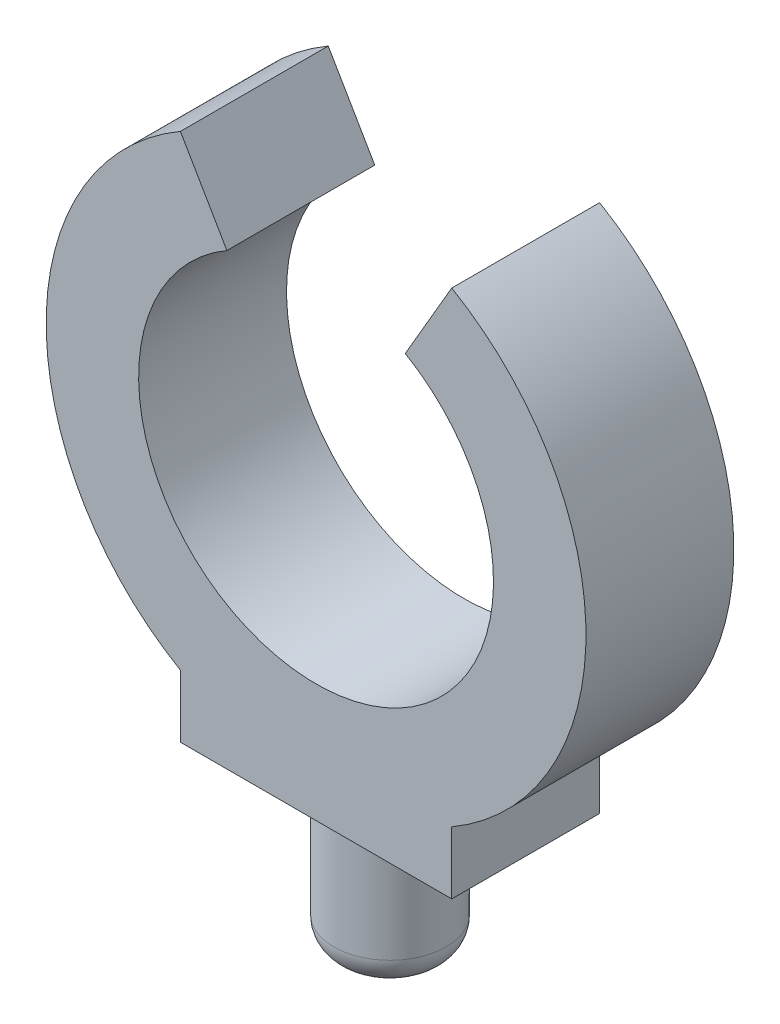
from build123d import *

# Parameters (mm, degrees)
RESSALTO_EXTRUS_O1_DEPTH     = 5
RESSALTO_EXTRUS_O2_START     = -15
RESSALTO_EXTRUS_O2_OUTLINE_R = 1.9
RESSALTO_EXTRUS_O2_DEPTH     = 5
FILETE5_R                    = 1


# Read off the part's stored shape, not the designer's step: Ressalto-extrusão2
with BuildPart() as part:
    # Esboço1 → Ressalto-extrusão1 (new body)
    with BuildSketch(Plane.XY):
        with BuildLine():
            Line((4.587776734, -7.88962854), (4.587776734, -10))
            Line((4.587776734, -10), (-4.587776734, -10))
            Line((-4.587776734, -10), (-4.587776734, -7.88962854))
            ThreePointArc((-4.587776734, -7.88962854), (-9.126551039, 0), (-4.587776734, 7.88962854))
            Line((-4.587776734, 7.88962854), (-3.01610765, 5.186819319))
            ThreePointArc((-3.01610765, 5.186819319), (0, -6), (3.01610765, 5.186819319))
            Line((3.01610765, 5.186819319), (4.587776734, 7.88962854))
            ThreePointArc((4.587776734, 7.88962854), (9.126551039, 0), (4.587776734, -7.88962854))
        make_face()
    extrude(amount=RESSALTO_EXTRUS_O1_DEPTH)

    # Ressalto-extrusão2 outline → Ressalto-extrusão2 (add)
    with BuildSketch(Plane(origin=(0, 0, 0), x_dir=(1, 0, 0), z_dir=(0, 1, 0)).offset(RESSALTO_EXTRUS_O2_START)):
        with Locations((0, -2.5)):
            Circle(RESSALTO_EXTRUS_O2_OUTLINE_R)
    extrude(amount=RESSALTO_EXTRUS_O2_DEPTH)

    # Filete5
    filete5_edges = [part.edges().sort_by_distance(p)[0] for p in [
        (-1.9, -15, 2.5),
    ]]
    fillet(filete5_edges, radius=FILETE5_R)


solid = part.part
